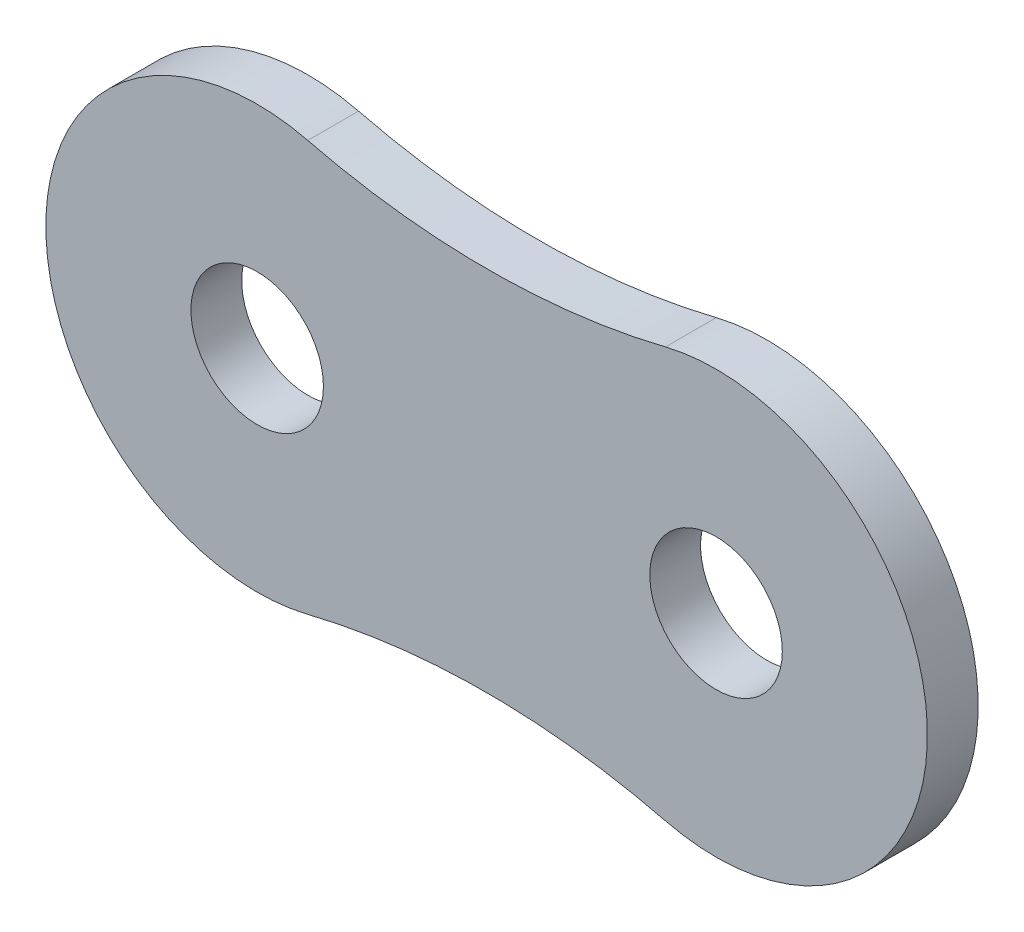
from build123d import *

# Parameters (mm, degrees)
EXTRUDE_1_DEPTH     = 0.885
SKETCH_3_R          = 1.155
CUT_EXTRUDE_1_DEPTH = 9.568644875


with BuildPart() as part:
    # 草图2 → 拉伸1 (new body)
    with BuildSketch(Plane.XY):
        with BuildLine():
            ThreePointArc((-3.118453102, 3.578002245), (-7.685, 0), (-3.118453102, -3.578002245))
            ThreePointArc((-3.118453102, -3.578002245), (0, -3.1995), (3.118453102, -3.578002245))
            ThreePointArc((3.118453102, -3.578002245), (7.685, 0), (3.118453102, 3.578002245))
            ThreePointArc((3.118453102, 3.578002245), (0, 3.1995), (-3.118453102, 3.578002245))
        make_face()
    extrude(amount=EXTRUDE_1_DEPTH)

    # 草图3 → 切除-拉伸1 (cut, through all)
    with BuildSketch(Plane.XY.offset(0.885)):
        with Locations((-4, 0)):
            Circle(SKETCH_3_R)
        with Locations((4, 0)):
            Circle(SKETCH_3_R)
    extrude(amount=-CUT_EXTRUDE_1_DEPTH, mode=Mode.SUBTRACT)


solid = part.part
